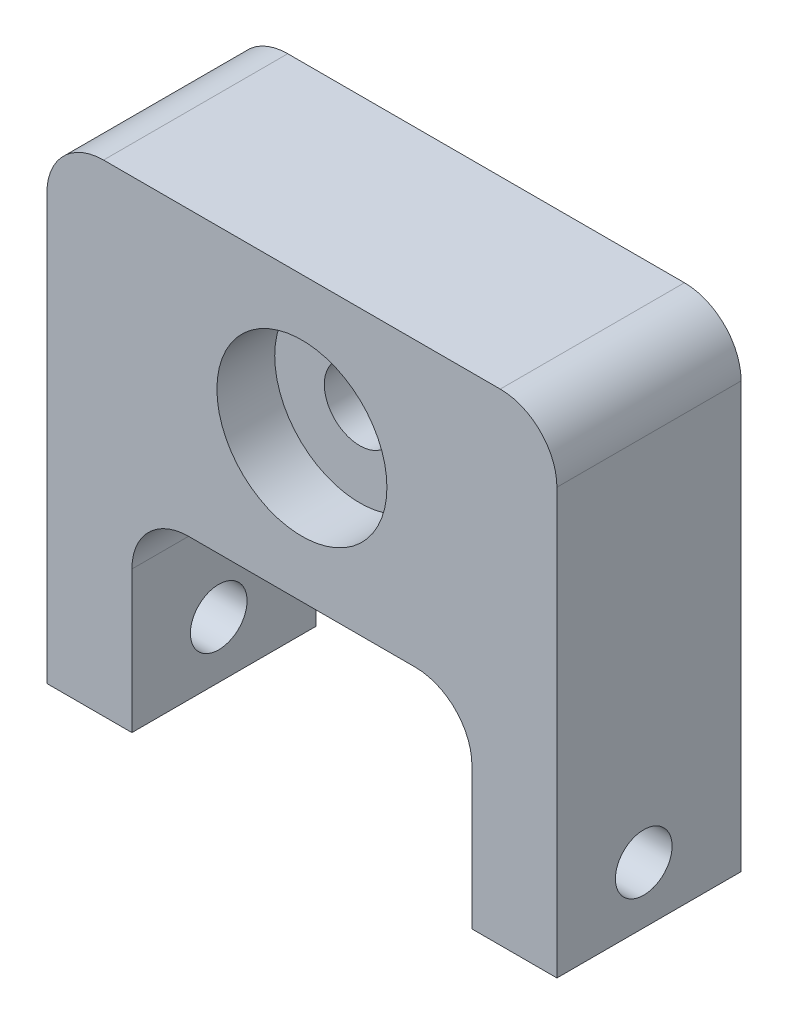
from build123d import *

# Parameters (mm, degrees)
SKETCH1_W           = 57.15
SKETCH1_H           = 31.75
BOSS_EXTRUDE1_DEPTH = 20.6375
SKETCH2_R           = 11.1125
CUT_EXTRUDE1_DEPTH  = 6.985
SKETCH3_R           = 8.255
CUT_EXTRUDE2_DEPTH  = 2.413
SKETCH4_R           = 3.96875
CUT_EXTRUDE3_DEPTH  = 35.56692943
CUT_EXTRUDE4_START  = -4.7625
SKETCH6_R           = 9.525
CUT_EXTRUDE4_DEPTH  = 30.80442943
SKETCH7_W           = 9.525
SKETCH7_H           = 20.6375
BOSS_EXTRUDE2_DEPTH = 22.225
SKETCH9_R           = 3.175
CUT_EXTRUDE5_DEPTH  = 72.719166938
FILLET1_R           = 6.35


with BuildPart() as part:
    # Sketch1 → Boss-Extrude1 (new body)
    with BuildSketch(Plane.XY):
        Rectangle(SKETCH1_W, SKETCH1_H)
    extrude(amount=BOSS_EXTRUDE1_DEPTH)

    # Sketch2 → Cut-Extrude1 (cut)
    with BuildSketch(Plane(origin=(0, 0, 0), x_dir=(-1, 0, 0), z_dir=(0, 0, -1))):
        Circle(SKETCH2_R)
    extrude(amount=-CUT_EXTRUDE1_DEPTH, mode=Mode.SUBTRACT)

    # Sketch3 → Cut-Extrude2 (cut)
    with BuildSketch(Plane(origin=(0, 0, 6.985), x_dir=(-1, 0, 0), z_dir=(0, 0, -1))):
        Circle(SKETCH3_R)
    extrude(amount=-CUT_EXTRUDE2_DEPTH, mode=Mode.SUBTRACT)

    # Sketch4 → Cut-Extrude3 (cut, through all)
    with BuildSketch(Plane(origin=(0, 0, 9.398), x_dir=(-1, 0, 0), z_dir=(0, 0, -1))):
        Circle(SKETCH4_R)
    extrude(amount=-CUT_EXTRUDE3_DEPTH, mode=Mode.SUBTRACT)

    # Sketch6 → Cut-Extrude4 (cut, through all)
    with BuildSketch(Plane(origin=(0, 0, 9.398), x_dir=(-1, 0, 0), z_dir=(0, 0, -1)).offset(CUT_EXTRUDE4_START)):
        Circle(SKETCH6_R)
    extrude(amount=-CUT_EXTRUDE4_DEPTH, mode=Mode.SUBTRACT)

    # Sketch7 → Boss-Extrude2 (add)
    with BuildSketch(Plane.XZ.offset(15.875)):
        with Locations((-23.8125, 10.31875)):
            Rectangle(SKETCH7_W, SKETCH7_H)
        with Locations((23.8125, 10.31875)):
            Rectangle(SKETCH7_W, SKETCH7_H)
    extrude(amount=BOSS_EXTRUDE2_DEPTH)

    # Sketch9 → Cut-Extrude5 (cut, through all)
    with BuildSketch(Plane(origin=(28.575, 0, 0), x_dir=(0, 0, -1), z_dir=(1, 0, 0))):
        with Locations((-10.909520599, -31.75)):
            Circle(SKETCH9_R)
    extrude(amount=-CUT_EXTRUDE5_DEPTH, mode=Mode.SUBTRACT)

    # Fillet1
    fillet1_edges = [part.edges().sort_by_distance(p)[0] for p in [
        (28.575, 15.875, 10.31875),
        (-28.575, 15.875, 10.31875),
        (19.05, -15.875, 10.31875),
        (-19.05, -15.875, 10.31875),
    ]]
    fillet(fillet1_edges, radius=FILLET1_R)


solid = part.part
